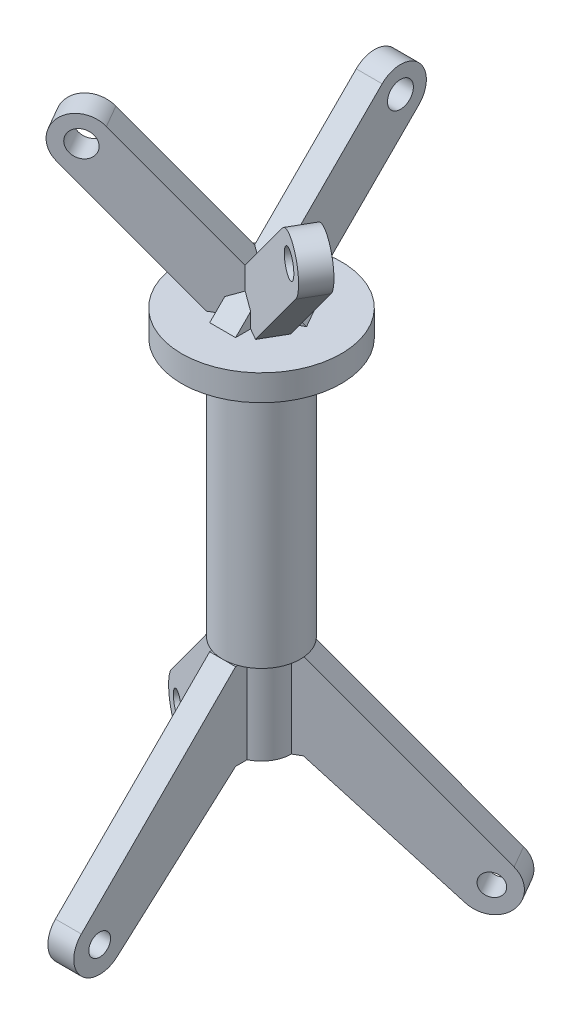
from build123d import *

# Parameters (mm, degrees)
CROQUIS3_R               = 7.5
SALIENTE_EXTRUIR10_DEPTH = 7.5
SALIENTE_EXTRUIR24_DEPTH = 7.5
CROQUIS5_R               = 6.3
CORTAR_EXTRUIR1_DEPTH    = 10
MATRIZC1_COUNT           = 3
MATRIZC2_START           = -8.85913735
MATRIZC2_OUTLINE_R       = 6.3
MATRIZC2_DEPTH           = 15
MATRIZC2_START_2         = -6.14086265
MATRIZC2_2_OUTLINE_R     = 6.3
MATRIZC2_2_DEPTH         = 15
MATRIZC3_COUNT           = 3


# Read off the part's stored shape, not the designer's step: MatrizC2
with BuildPart() as part:
    # Croquis1 → Revolución1 (revolve)
    with BuildSketch(Plane(origin=(0, 0, 0), x_dir=(0, 0, -1), z_dir=(1, 0, 0)), mode=Mode.PRIVATE) as revoluci_n1_sk:
        Polygon((0, 90), (0, -125), (17.5, -125), (17.5, -75), (22.5, -75), (22.5, 75), (46.2, 75), (46.2, 90), align=None)
    revolve(revoluci_n1_sk.sketch.rotate(Axis((0, 90, 0), (0, -1, 0)), 180), axis=Axis((0, 90, 0), (0, -1, 0)))

    # Croquis3 → Saliente-Extruir10 (add, symmetric)
    with BuildSketch(Plane(origin=(0, 0, 0), x_dir=(0, 0, -1), z_dir=(1, 0, 0))):
        with BuildLine():
            Line((-22.5, 90), (19.926406871, 90))
            Line((19.926406871, 90), (83.566017178, 153.639610307))
            ThreePointArc((83.566017178, 153.639610307), (83.566017178, 174.852813742), (62.352813742, 174.852813742))
            Line((62.352813742, 174.852813742), (-22.5, 90))
        make_face()
        with Locations((72.95941546, 164.246212025)):
            Circle(CROQUIS3_R, mode=Mode.SUBTRACT)
    saliente_extruir10 = extrude(amount=SALIENTE_EXTRUIR10_DEPTH, both=True)

    # Croquis4 → Saliente-Extruir24 (add, symmetric)
    with BuildSketch(Plane(origin=(0, 0, 0), x_dir=(0, 0, -1), z_dir=(1, 0, 0))):
        with BuildLine():
            Line((-22.5, -75), (-111.800673807, -164.399250863))
            ThreePointArc((-111.800673807, -164.399250863), (-112.093769258, -185.298983205), (-91.211457576, -186.201078383))
            Line((-91.211457576, -186.201078383), (-22.5, -125))
            Line((-22.5, -125), (-3.021288489, -125))
            Line((-3.021288489, -125), (-3.021288489, -75))
            Line((-3.021288489, -75), (-22.5, -75))
        make_face()
    saliente_extruir24 = extrude(amount=SALIENTE_EXTRUIR24_DEPTH, both=True)

    # Croquis5 → Cortar-Extruir1 (cut, symmetric)
    with BuildSketch(Plane(origin=(0, 0, 0), x_dir=(0, 0, -1), z_dir=(1, 0, 0))):
        with Locations((-101.188222736, -175)):
            Circle(CROQUIS5_R)
    extrude(amount=CORTAR_EXTRUIR1_DEPTH, both=True, mode=Mode.SUBTRACT)

    # MatrizC1: Saliente-Extruir24 ×3 about axis
    matrizc1_axis = Axis((0, 0, 1.56939663), (0, 1, 0))
    for i in range(1, MATRIZC1_COUNT):
        add(saliente_extruir24.rotate(matrizc1_axis, i * 360 / MATRIZC1_COUNT))

    # MatrizC2 outline → MatrizC2 (cut)
    with BuildSketch(Plane(origin=(0, 0, 0), x_dir=(0.8660254037844362, 0, 0.5000000000000042), z_dir=(0.5000000000000042, 0, -0.8660254037844363)).offset(MATRIZC2_START)):
        with Locations((-100.01457544, 175)):
            Circle(MATRIZC2_OUTLINE_R)
    extrude(amount=MATRIZC2_DEPTH, mode=Mode.SUBTRACT)

    # MatrizC2 2 outline → MatrizC2 2 (cut)
    with BuildSketch(Plane(origin=(0, 0, 0), x_dir=(0.8660254037844431, 0, -0.4999999999999921), z_dir=(0.4999999999999921, 0, 0.8660254037844433)).offset(MATRIZC2_START_2)):
        with Locations((100.01457544, -175)):
            Circle(MATRIZC2_2_OUTLINE_R)
    extrude(amount=MATRIZC2_2_DEPTH, mode=Mode.SUBTRACT)

    # MatrizC3: Saliente-Extruir10 ×3 about axis
    matrizc3_axis = Axis((0, 0, 0.782431531), (0, 1, 0))
    for i in range(1, MATRIZC3_COUNT):
        add(saliente_extruir10.rotate(matrizc3_axis, i * 360 / MATRIZC3_COUNT))


solid = part.part
